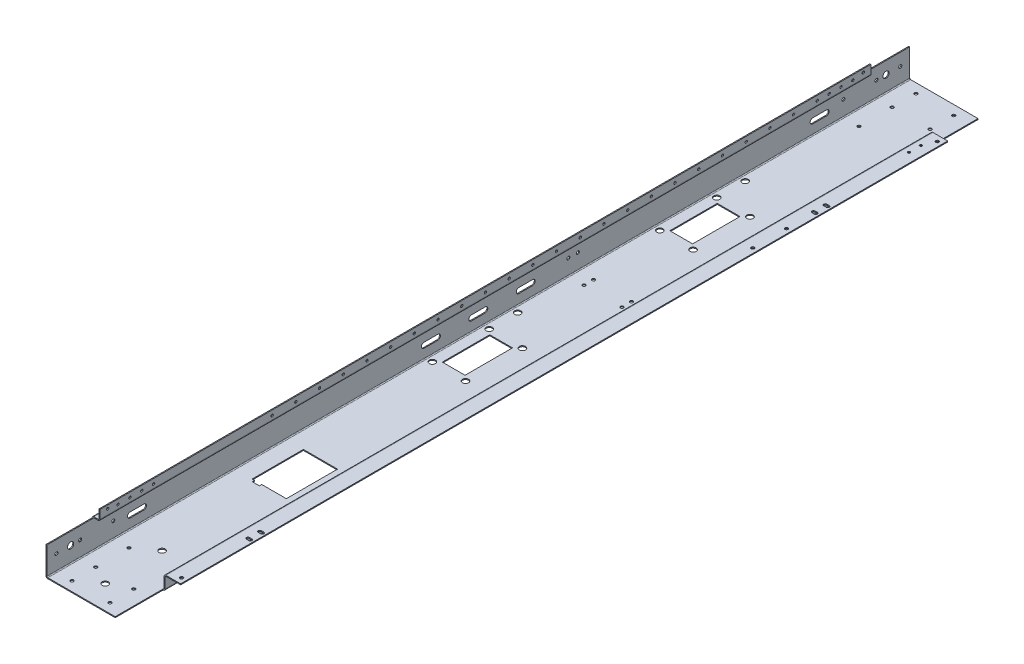
from build123d import *

# Parameters (mm, degrees)
SM_BASE_FLANGE_1_DEPTH    = 910
SKETCH_6_W                = 101
SKETCH_6_H                = 30
CUT_EXTRUDE_1_DEPTH       = 37
SKETCH_7_W                = 17
SKETCH_7_H                = 97
CUT_EXTRUDE_2_DEPTH       = 24
SKETCH_8_R                = 6.5
SKETCH_8_R_2              = 3.25
CUT_EXTRUDE_3_DEPTH       = 10
SKETCH_9_R                = 3.25
CUT_EXTRUDE_4_DEPTH       = 10
SKETCH_13_R               = 3.25
CUT_EXTRUDE_6_DEPTH       = 10
CUT_EXTRUDE_7_DEPTH       = 10
CUT_EXTRUDE_8_DEPTH       = 10
SKETCH_16_R               = 3.25
SKETCH_16_R_2             = 6.5
CUT_EXTRUDE_9_DEPTH       = 10
SKETCH_17_R               = 2.5
CUT_EXTRUDE_10_DEPTH      = 10
MOVE_BODY_1_OUTLINE_R     = 3.25
MOVE_BODY_1_DEPTH         = 2
MOVE_START                = -28
MOVE_BODY_1_2_OUTLINE_R   = 6.5
MOVE_BODY_1_2_OUTLINE_R_2 = 3.25
MOVE_BODY_1_2_DEPTH       = 2
MOVE_START_2              = -168
MOVE_BODY_1_3_OUTLINE_R   = 2.5
MOVE_BODY_1_3_DEPTH       = 2
MOVE_START_3              = -183
MOVE_BODY_1_4_OUTLINE_R   = 3.25
MOVE_BODY_1_4_DEPTH       = 2
MOVE_BODY_1_5_OUTLINE_R   = 6.5
MOVE_BODY_1_5_OUTLINE_R_2 = 3.25
MOVE_BODY_1_5_DEPTH       = 30
MOVE_BODY_1_6_OUTLINE_R   = 3.25
MOVE_BODY_1_6_OUTLINE_R_2 = 2.5
MOVE_BODY_1_6_DEPTH       = 17
SKETCH_18_W               = 72
SKETCH_18_H               = 108
SKETCH_18_W_2             = 15
SKETCH_18_H_2             = 5
CUT_EXTRUDE_7603_DEPTH    = 10
SKETCH_21_R               = 6.5
CUT_EXTRUDE_13_DEPTH      = 10
SKETCH_28_R               = 6.5
SKETCH_28_W               = 48
SKETCH_28_H               = 100
CUT_EXTRUDE_9110_DEPTH    = 10
SKETCH_31_R               = 2.5
CUT_EXTRUDE_10647_DEPTH   = 10


# Read off the part's stored shape, not the designer's step: Тело-Переместить/Копировать1
# Sheet-metal steps are written as plain solids
with BuildPart() as part:
    # Sketch 1 → Базовая кромка1 (new, symmetric)
    with BuildSketch(Plane.XY):
        with BuildLine():
            Line((0, 0), (-31, 0))
            ThreePointArc((-31, 0), (-32.414213562, -0.585786438), (-33, -2))
            Line((-33, -2), (-33, -24))
            ThreePointArc((-33, -24), (-34.171572875, -26.828427125), (-37, -28))
            Line((-37, -28), (-179, -28))
            ThreePointArc((-179, -28), (-181.828427125, -26.828427125), (-183, -24))
            Line((-183, -24), (-183, 33))
            ThreePointArc((-183, 33), (-181.828427125, 35.828427125), (-179, 37))
            Line((-179, 37), (-170, 37))
            ThreePointArc((-170, 37), (-168.585786438, 37.585786438), (-168, 39))
            Line((-168, 39), (-168, 57))
            Line((-168, 57), (-166, 57))
            Line((-166, 57), (-166, 39))
            ThreePointArc((-166, 39), (-167.171572875, 36.171572875), (-170, 35))
            Line((-170, 35), (-179, 35))
            ThreePointArc((-179, 35), (-180.414213562, 34.414213562), (-181, 33))
            Line((-181, 33), (-181, -24))
            ThreePointArc((-181, -24), (-180.414213562, -25.414213562), (-179, -26))
            Line((-179, -26), (-37, -26))
            ThreePointArc((-37, -26), (-35.585786438, -25.414213562), (-35, -24))
            Line((-35, -24), (-35, -2))
            ThreePointArc((-35, -2), (-33.828427125, 0.828427125), (-31, 2))
            Line((-31, 2), (0, 2))
            Line((0, 2), (0, 0))
        make_face()
    extrude(amount=SM_BASE_FLANGE_1_DEPTH, both=True)

    # Эскиз6 → Cut-Extrude 1 (cut)
    with BuildSketch(Plane(origin=(0, 0, 0), x_dir=(0, 0, -1), z_dir=(1, 0, 0))):
        with Locations((-859.5, -13)):
            Rectangle(SKETCH_6_W, SKETCH_6_H)
        with Locations((859.5, -13)):
            Rectangle(SKETCH_6_W, SKETCH_6_H)
    extrude(amount=-CUT_EXTRUDE_1_DEPTH, mode=Mode.SUBTRACT)

    # Эскиз7 → Вырез-Вытянуть2 (cut)
    with BuildSketch(Plane(origin=(0, 57, 0), x_dir=(1, 0, 0), z_dir=(0, 1, 0))):
        with Locations((-174.5, -861.5)):
            Rectangle(SKETCH_7_W, SKETCH_7_H)
        with Locations((-174.5, 861.5)):
            Rectangle(SKETCH_7_W, SKETCH_7_H)
    extrude(amount=-CUT_EXTRUDE_2_DEPTH, mode=Mode.SUBTRACT)

    # Эскиз8 → Вырез-Вытянуть3 (cut)
    with BuildSketch(Plane(origin=(0, -26, 0), x_dir=(1, 0, 0), z_dir=(0, 1, 0))):
        with Locations(Location((-108, 860, 0), (0, 0, 180))):
            Circle(SKETCH_8_R)
        with Locations(Location((-68, 890, 0), (0, 0, 180))):
            Circle(SKETCH_8_R_2)
        with Locations(Location((-148, 890, 0), (0, 0, 180))):
            Circle(SKETCH_8_R_2)
        with Locations(Location((-148, 840, 0), (0, 0, 180))):
            Circle(SKETCH_8_R_2)
        with Locations(Location((-68, 840, 0), (0, 0, 180))):
            Circle(SKETCH_8_R_2)
        with Locations(Location((-148, 770, 0), (0, 0, 180))):
            Circle(SKETCH_8_R_2)
        with Locations((-148, -770)):
            Circle(SKETCH_8_R_2)
        with Locations((-148, -890)):
            Circle(SKETCH_8_R_2)
        with Locations((-148, -840)):
            Circle(SKETCH_8_R_2)
        with Locations((-68, -840)):
            Circle(SKETCH_8_R_2)
        with Locations((-68, -890)):
            Circle(SKETCH_8_R_2)
    extrude(amount=-CUT_EXTRUDE_3_DEPTH, mode=Mode.SUBTRACT)

    # Эскиз9 → Вырез-Вытянуть4 (cut)
    with BuildSketch(Plane(origin=(0, -26, 0), x_dir=(1, 0, 0), z_dir=(0, 1, 0))):
        with Locations(Location((-68, -190, 0), (0, 0, 180))):
            Circle(SKETCH_9_R)
        with Locations(Location((-148, -190, 0), (0, 0, 180))):
            Circle(SKETCH_9_R)
        with Locations(Location((-148, -210, 0), (0, 0, 180))):
            Circle(SKETCH_9_R)
        with Locations(Location((-68, -210, 0), (0, 0, 180))):
            Circle(SKETCH_9_R)
    cut_extrude_4 = extrude(amount=-CUT_EXTRUDE_4_DEPTH, mode=Mode.SUBTRACT)

    # Зеркальное отражение1: Вырез-Вытянуть4 across plane
    add(cut_extrude_4.mirror(Plane(origin=(-77.5, 77.5, 0), x_dir=(0, 0, 1), z_dir=(-0.7071067811865476, 0.7071067811865475, 0))), mode=Mode.SUBTRACT)

    # Эскиз13 → Вырез-Вытянуть6 (cut)
    with BuildSketch(Plane.XZ):
        with Locations(Location((-10, -797, 0), (0, 0, 270))):
            Circle(SKETCH_13_R)
        with Locations(Location((-10, 797, 0), (0, 0, 270))):
            Circle(SKETCH_13_R)
        with Locations(Location((-10, 479, 0), (0, 0, 270))):
            Circle(SKETCH_13_R)
        with Locations(Location((-10, 408, 0), (0, 0, 270))):
            Circle(SKETCH_13_R)
    extrude(amount=-CUT_EXTRUDE_6_DEPTH, mode=Mode.SUBTRACT)

    # Эскиз14 → Вырез-Вытянуть7 (cut)
    with BuildSketch(Plane.XZ):
        with BuildLine():
            Line((-12, 566.25), (-7, 566.25))
            ThreePointArc((-7, 566.25), (-3.75, 563), (-7, 559.75))
            Line((-7, 559.75), (-12, 559.75))
            ThreePointArc((-12, 559.75), (-15.25, 563), (-12, 566.25))
        make_face()
        with BuildLine():
            Line((-12, 541.25), (-7, 541.25))
            ThreePointArc((-7, 541.25), (-3.75, 538), (-7, 534.75))
            Line((-7, 534.75), (-12, 534.75))
            ThreePointArc((-12, 534.75), (-15.25, 538), (-12, 541.25))
        make_face()
        with BuildLine():
            Line((-12, -626.75), (-7, -626.75))
            ThreePointArc((-7, -626.75), (-3.75, -630), (-7, -633.25))
            Line((-7, -633.25), (-12, -633.25))
            ThreePointArc((-12, -633.25), (-15.25, -630), (-12, -626.75))
        make_face()
        with BuildLine():
            Line((-12, -651.75), (-7, -651.75))
            ThreePointArc((-7, -651.75), (-3.75, -655), (-7, -658.25))
            Line((-7, -658.25), (-12, -658.25))
            ThreePointArc((-12, -658.25), (-15.25, -655), (-12, -651.75))
        make_face()
    extrude(amount=-CUT_EXTRUDE_7_DEPTH, mode=Mode.SUBTRACT)

    # Эскиз15 → Вырез-Вытянуть8 (cut)
    with BuildSketch(Plane.ZY.offset(183)):
        with BuildLine():
            Line((-734.5, 5.5), (-705.5, 5.5))
            ThreePointArc((-705.5, 5.5), (-700, 0), (-705.5, -5.5))
            Line((-705.5, -5.5), (-734.5, -5.5))
            ThreePointArc((-734.5, -5.5), (-740, 0), (-734.5, 5.5))
        make_face()
        with BuildLine():
            Line((-85.5, -5.5), (-114.5, -5.5))
            ThreePointArc((-114.5, -5.5), (-120, 0), (-114.5, 5.5))
            Line((-114.5, 5.5), (-85.5, 5.5))
            ThreePointArc((-85.5, 5.5), (-80, 0), (-85.5, -5.5))
        make_face()
        with BuildLine():
            Line((14.5, -5.5), (-14.5, -5.5))
            ThreePointArc((-14.5, -5.5), (-20, 0), (-14.5, 5.5))
            Line((-14.5, 5.5), (14.5, 5.5))
            ThreePointArc((14.5, 5.5), (20, 0), (14.5, -5.5))
        make_face()
        with BuildLine():
            Line((114.5, -5.5), (85.5, -5.5))
            ThreePointArc((85.5, -5.5), (80, 0), (85.5, 5.5))
            Line((85.5, 5.5), (114.5, 5.5))
            ThreePointArc((114.5, 5.5), (120, 0), (114.5, -5.5))
        make_face()
        with BuildLine():
            Line((734.5, -5.5), (705.5, -5.5))
            ThreePointArc((705.5, -5.5), (700, 0), (705.5, 5.5))
            Line((705.5, 5.5), (734.5, 5.5))
            ThreePointArc((734.5, 5.5), (740, 0), (734.5, -5.5))
        make_face()
    extrude(amount=-CUT_EXTRUDE_8_DEPTH, mode=Mode.SUBTRACT)

    # Эскиз16 → Вырез-Вытянуть9 (cut)
    with BuildSketch(Plane.ZY.offset(183)):
        with Locations((890, 7)):
            Circle(SKETCH_16_R)
        with Locations((860, 7)):
            Circle(SKETCH_16_R_2)
        with Locations((840, 7)):
            Circle(SKETCH_16_R)
        with Locations((770, 7)):
            Circle(SKETCH_16_R)
        with Locations(Location((-770, 7, 0), (0, 0, 180))):
            Circle(SKETCH_16_R)
        with Locations(Location((-840, 7, 0), (0, 0, 180))):
            Circle(SKETCH_16_R)
        with Locations(Location((-860, 7, 0), (0, 0, 180))):
            Circle(SKETCH_16_R_2)
        with Locations(Location((-890, 7, 0), (0, 0, 180))):
            Circle(SKETCH_16_R)
    extrude(amount=-CUT_EXTRUDE_9_DEPTH, mode=Mode.SUBTRACT)

    # Эскиз17 → Вырез-Вытянуть10 (cut)
    with BuildSketch(Plane.ZY.offset(168)):
        with Locations((775, 47)):
            Circle(SKETCH_17_R)
        with Locations((650, 47)):
            Circle(SKETCH_17_R)
        with Locations((-775, 47)):
            Circle(SKETCH_17_R)
        with Locations((-797, 50)):
            Circle(SKETCH_17_R)
        with Locations((797, 50)):
            Circle(SKETCH_17_R)
        with Locations((750, 47)):
            Circle(SKETCH_17_R)
        with Locations((725, 47)):
            Circle(SKETCH_17_R)
        with Locations((700, 47)):
            Circle(SKETCH_17_R)
        with Locations((600, 47)):
            Circle(SKETCH_17_R)
        with Locations((550, 47)):
            Circle(SKETCH_17_R)
        with Locations((500, 47)):
            Circle(SKETCH_17_R)
        with Locations((450, 47)):
            Circle(SKETCH_17_R)
        with Locations((400, 47)):
            Circle(SKETCH_17_R)
        with Locations((350, 47)):
            Circle(SKETCH_17_R)
        with Locations((300, 47)):
            Circle(SKETCH_17_R)
        with Locations((250, 47)):
            Circle(SKETCH_17_R)
        with Locations((200, 47)):
            Circle(SKETCH_17_R)
        with Locations((150, 47)):
            Circle(SKETCH_17_R)
        with Locations((100, 47)):
            Circle(SKETCH_17_R)
        with Locations((50, 47)):
            Circle(SKETCH_17_R)
        with Locations((0, 47)):
            Circle(SKETCH_17_R)
        with Locations((-50, 47)):
            Circle(SKETCH_17_R)
        with Locations((-100, 47)):
            Circle(SKETCH_17_R)
        with Locations((-150, 47)):
            Circle(SKETCH_17_R)
        with Locations((-200, 47)):
            Circle(SKETCH_17_R)
        with Locations((-750, 47)):
            Circle(SKETCH_17_R)
        with Locations((-725, 47)):
            Circle(SKETCH_17_R)
        with Locations((-700, 47)):
            Circle(SKETCH_17_R)
        with Locations((-250, 47)):
            Circle(SKETCH_17_R)
        with Locations((-300, 47)):
            Circle(SKETCH_17_R)
        with Locations((-350, 47)):
            Circle(SKETCH_17_R)
        with Locations((-400, 47)):
            Circle(SKETCH_17_R)
        with Locations((-450, 47)):
            Circle(SKETCH_17_R)
    extrude(amount=-CUT_EXTRUDE_10_DEPTH, mode=Mode.SUBTRACT)

    # Move Body 1 outline → Move Body 1 (add)
    with BuildSketch(Plane(origin=(0, 0, 0), x_dir=(1, 0, 0), z_dir=(0, 1, 0))):
        with Locations((-10, -408)):
            Circle(MOVE_BODY_1_OUTLINE_R)
        with Locations((-10, -479)):
            Circle(MOVE_BODY_1_OUTLINE_R)
        with BuildLine():
            ThreePointArc((-12, 658.25), (-15.25, 655), (-12, 651.75))
            Line((-12, 651.75), (-7, 651.75))
            ThreePointArc((-7, 651.75), (-3.75, 655), (-7, 658.25))
            Line((-7, 658.25), (-12, 658.25))
        make_face()
        with BuildLine():
            ThreePointArc((-12, 633.25), (-15.25, 630), (-12, 626.75))
            Line((-12, 626.75), (-7, 626.75))
            ThreePointArc((-7, 626.75), (-3.75, 630), (-7, 633.25))
            Line((-7, 633.25), (-12, 633.25))
        make_face()
        with BuildLine():
            ThreePointArc((-12, -534.75), (-15.25, -538), (-12, -541.25))
            Line((-12, -541.25), (-7, -541.25))
            ThreePointArc((-7, -541.25), (-3.75, -538), (-7, -534.75))
            Line((-7, -534.75), (-12, -534.75))
        make_face()
        with BuildLine():
            ThreePointArc((-12, -559.75), (-15.25, -563), (-12, -566.25))
            Line((-12, -566.25), (-7, -566.25))
            ThreePointArc((-7, -566.25), (-3.75, -563), (-7, -559.75))
            Line((-7, -559.75), (-12, -559.75))
        make_face()
    extrude(amount=MOVE_BODY_1_DEPTH)

    # Move Body 1 2 outline → Move Body 1 2 (add)
    with BuildSketch(Plane(origin=(0, 0, 0), x_dir=(1, 0, 0), z_dir=(0, 1, 0)).offset(MOVE_START)):
        with Locations((-108, 860)):
            Circle(MOVE_BODY_1_2_OUTLINE_R)
        with Locations((-68, -190)):
            Circle(MOVE_BODY_1_2_OUTLINE_R_2)
        with Locations((-148, -190)):
            Circle(MOVE_BODY_1_2_OUTLINE_R_2)
        with Locations((-148, -210)):
            Circle(MOVE_BODY_1_2_OUTLINE_R_2)
        with Locations((-68, -210)):
            Circle(MOVE_BODY_1_2_OUTLINE_R_2)
    extrude(amount=MOVE_BODY_1_2_DEPTH)

    # Move Body 1 3 outline → Move Body 1 3 (add)
    with BuildSketch(Plane.YZ.offset(MOVE_START_2)):
        with Locations((47, 500)):
            Circle(MOVE_BODY_1_3_OUTLINE_R)
        with Locations((47, 550)):
            Circle(MOVE_BODY_1_3_OUTLINE_R)
        with Locations((47, 600)):
            Circle(MOVE_BODY_1_3_OUTLINE_R)
        with Locations((47, 650)):
            Circle(MOVE_BODY_1_3_OUTLINE_R)
    extrude(amount=MOVE_BODY_1_3_DEPTH)

    # Move Body 1 4 outline → Move Body 1 4 (add)
    with BuildSketch(Plane.YZ.offset(MOVE_START_3)):
        with Locations((7, 190)):
            Circle(MOVE_BODY_1_4_OUTLINE_R)
        with Locations((7, 210)):
            Circle(MOVE_BODY_1_4_OUTLINE_R)
    extrude(amount=MOVE_BODY_1_4_DEPTH)

    # Move Body 1 5 outline → Move Body 1 5 (cut)
    with BuildSketch(Plane(origin=(0, 0, 0), x_dir=(1, 0, 0), z_dir=(0, 1, 0)).offset(MOVE_START)):
        with Locations((-108, -860)):
            Circle(MOVE_BODY_1_5_OUTLINE_R)
        with Locations((-68, 190)):
            Circle(MOVE_BODY_1_5_OUTLINE_R_2)
        with Locations((-148, 190)):
            Circle(MOVE_BODY_1_5_OUTLINE_R_2)
        with Locations((-148, 210)):
            Circle(MOVE_BODY_1_5_OUTLINE_R_2)
        with Locations((-68, 210)):
            Circle(MOVE_BODY_1_5_OUTLINE_R_2)
        with Locations((-10, 408)):
            Circle(MOVE_BODY_1_5_OUTLINE_R_2)
        with Locations((-10, 479)):
            Circle(MOVE_BODY_1_5_OUTLINE_R_2)
        with BuildLine():
            ThreePointArc((-12, -651.75), (-15.25, -655), (-12, -658.25))
            Line((-12, -658.25), (-7, -658.25))
            ThreePointArc((-7, -658.25), (-3.75, -655), (-7, -651.75))
            Line((-7, -651.75), (-12, -651.75))
        make_face()
        with BuildLine():
            ThreePointArc((-12, -626.75), (-15.25, -630), (-12, -633.25))
            Line((-12, -633.25), (-7, -633.25))
            ThreePointArc((-7, -633.25), (-3.75, -630), (-7, -626.75))
            Line((-7, -626.75), (-12, -626.75))
        make_face()
        with BuildLine():
            ThreePointArc((-12, 541.25), (-15.25, 538), (-12, 534.75))
            Line((-12, 534.75), (-7, 534.75))
            ThreePointArc((-7, 534.75), (-3.75, 538), (-7, 541.25))
            Line((-7, 541.25), (-12, 541.25))
        make_face()
        with BuildLine():
            ThreePointArc((-12, 566.25), (-15.25, 563), (-12, 559.75))
            Line((-12, 559.75), (-7, 559.75))
            ThreePointArc((-7, 559.75), (-3.75, 563), (-7, 566.25))
            Line((-7, 566.25), (-12, 566.25))
        make_face()
    extrude(amount=MOVE_BODY_1_5_DEPTH, mode=Mode.SUBTRACT)

    # Move Body 1 6 outline → Move Body 1 6 (cut)
    with BuildSketch(Plane.YZ.offset(MOVE_START_3)):
        with Locations((7, -190)):
            Circle(MOVE_BODY_1_6_OUTLINE_R)
        with Locations((7, -210)):
            Circle(MOVE_BODY_1_6_OUTLINE_R)
        with Locations((47, -500)):
            Circle(MOVE_BODY_1_6_OUTLINE_R_2)
        with Locations((47, -550)):
            Circle(MOVE_BODY_1_6_OUTLINE_R_2)
        with Locations((47, -600)):
            Circle(MOVE_BODY_1_6_OUTLINE_R_2)
        with Locations((47, -650)):
            Circle(MOVE_BODY_1_6_OUTLINE_R_2)
    extrude(amount=MOVE_BODY_1_6_DEPTH, mode=Mode.SUBTRACT)

    # Эскиз18 → Cut-Extrude 7603 (cut)
    with BuildSketch(Plane.XZ.offset(28)):
        with Locations((-108, 460)):
            Rectangle(SKETCH_18_W, SKETCH_18_H)
        with Locations((-131.5, 516.5)):
            Rectangle(SKETCH_18_W_2, SKETCH_18_H_2)
    extrude(amount=-CUT_EXTRUDE_7603_DEPTH, mode=Mode.SUBTRACT)

    # Эскиз21 → Вырез-Вытянуть13 (cut)
    with BuildSketch(Plane.XZ.offset(28)):
        with Locations((-108, 740)):
            Circle(SKETCH_21_R)
    extrude(amount=-CUT_EXTRUDE_13_DEPTH, mode=Mode.SUBTRACT)

    # Эскиз28 → Cut-Extrude 9110 (cut)
    with BuildSketch(Plane.XZ.offset(28)):
        with Locations((-98, 110)):
            Circle(SKETCH_28_R)
        with Locations((-168, 110)):
            Circle(SKETCH_28_R)
        with Locations((-168, -10)):
            Circle(SKETCH_28_R)
        with Locations((-98, -10)):
            Circle(SKETCH_28_R)
        with Locations((-168, -70)):
            Circle(SKETCH_28_R)
        with Locations((-98, -370)):
            Circle(SKETCH_28_R)
        with Locations((-168, -370)):
            Circle(SKETCH_28_R)
        with Locations((-168, -490)):
            Circle(SKETCH_28_R)
        with Locations((-98, -490)):
            Circle(SKETCH_28_R)
        with Locations((-168, -550)):
            Circle(SKETCH_28_R)
        with Locations((-133, 50)):
            Rectangle(SKETCH_28_W, SKETCH_28_H)
        with Locations((-133, -430)):
            Rectangle(SKETCH_28_W, SKETCH_28_H)
    extrude(amount=-CUT_EXTRUDE_9110_DEPTH, mode=Mode.SUBTRACT)

    # Эскиз31 → Cut-Extrude 10647 (cut)
    with BuildSketch(Plane(origin=(0, 2, 0), x_dir=(1, 0, 0), z_dir=(0, 1, 0))):
        with Locations(Location((-20, 772.5, 0), (0, 0, 270))):
            Circle(SKETCH_31_R)
        with Locations(Location((-20, 747.5, 0), (0, 0, 270))):
            Circle(SKETCH_31_R)
    extrude(amount=-CUT_EXTRUDE_10647_DEPTH, mode=Mode.SUBTRACT)


solid = part.part
